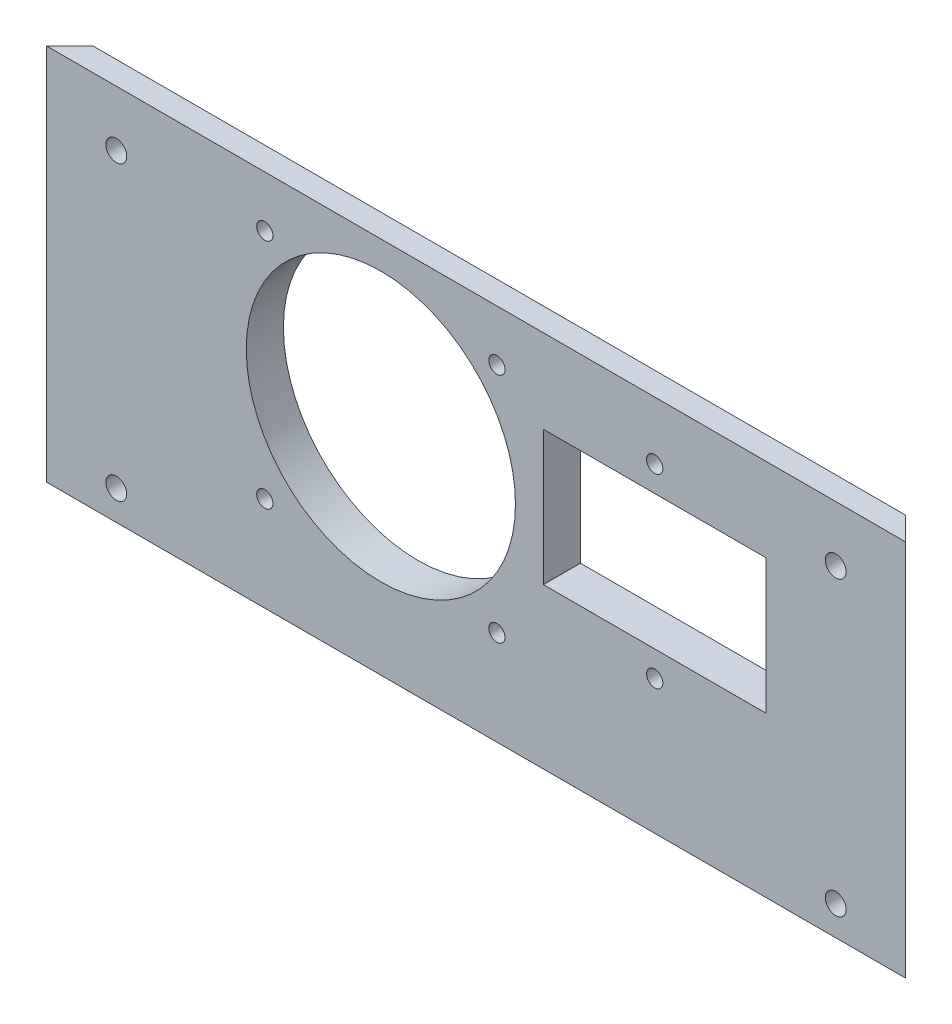
from build123d import *

# Parameters (mm, degrees)
SKETCH1_W           = 185
SKETCH1_H           = 84
SKETCH1_R           = 2.25
BOSS_EXTRUDE1_DEPTH = 5
SKETCH2_W           = 185
SKETCH2_H           = 79
SKETCH2_R           = 2.25
BOSS_EXTRUDE2_DEPTH = 3
CHAMFER1_SIZE       = 8
CHAMFER3_SIZE       = 3
SKETCH3_W           = 7.071067812
SKETCH3_H           = 2.6
CUT_EXTRUDE1_DEPTH  = 221.270985121
SKETCH4_R           = 29
SKETCH4_R_2         = 1.75
SKETCH4_W           = 48
SKETCH4_H           = 29
CUT_EXTRUDE2_DEPTH  = 204.334699449


with BuildPart() as part:
    # Sketch1 → Boss-Extrude1 (new body)
    with BuildSketch(Plane.XY):
        with Locations((92.5, 42)):
            Rectangle(SKETCH1_W, SKETCH1_H)
        with Locations((15, 9)):
            Circle(SKETCH1_R, mode=Mode.SUBTRACT)
        with Locations(Location((170, 9, 0), (0, 0, 180))):
            Circle(SKETCH1_R, mode=Mode.SUBTRACT)
        with Locations((15, 72)):
            Circle(SKETCH1_R, mode=Mode.SUBTRACT)
        with Locations(Location((170, 72, 0), (0, 0, 180))):
            Circle(SKETCH1_R, mode=Mode.SUBTRACT)
    extrude(amount=-BOSS_EXTRUDE1_DEPTH)

    # Sketch2 → Boss-Extrude2 (add)
    with BuildSketch(Plane(origin=(0, 0, -5), x_dir=(-1, 0, 0), z_dir=(0, 0, -1))):
        with Locations((-92.5, 44.5)):
            Rectangle(SKETCH2_W, SKETCH2_H)
        with Locations(Location((-15, 9, 0), (0, 0, 180))):
            Circle(SKETCH2_R, mode=Mode.SUBTRACT)
        with Locations((-170, 9)):
            Circle(SKETCH2_R, mode=Mode.SUBTRACT)
        with Locations(Location((-15, 72, 0), (0, 0, 180))):
            Circle(SKETCH2_R, mode=Mode.SUBTRACT)
        with Locations((-170, 72)):
            Circle(SKETCH2_R, mode=Mode.SUBTRACT)
    extrude(amount=BOSS_EXTRUDE2_DEPTH)

    # Chamfer1
    # the kernel refuses this chamfer: 8 mm, written as the material it takes off along each edge
    with BuildSketch(Plane(origin=(185, -15.573463904, -8), x_dir=(-0.9996219169112968, 0, -0.027495876610586296), z_dir=(0, 1, 0)), Plane(origin=(0, 104.573463904, -8), x_dir=(0.9996219169112968, 0, -0.027495876610586275), z_dir=(0, -1, 0))) as chamfer1_piece_1:
        Polygon((CHAMFER1_SIZE * 0.999621916911, CHAMFER1_SIZE * 0.0274958766106), (-CHAMFER1_SIZE * 0.0274958766106, CHAMFER1_SIZE * 0.999621916911), (0, 0), align=None)
    extrude(amount=120.146927807, mode=Mode.SUBTRACT)

    # Chamfer3
    chamfer3_edges = [part.edges().sort_by_distance(p)[0] for p in [
        (92.5, 84, -8),
    ]]
    chamfer(chamfer3_edges, length=CHAMFER3_SIZE)

    # Sketch3 → Cut-Extrude1 (cut, through all, along a direction that is not the sketch's normal)
    with BuildSketch(Plane(origin=(92.5, 0, -92.5), x_dir=(-0.7071067811865452, 0, -0.7071067811865498), z_dir=(0.7071067811865498, 0, -0.7071067811865452))):
        with Locations((-127.279220614, 1.3)):
            Rectangle(SKETCH3_W, SKETCH3_H)
    extrude(amount=-CUT_EXTRUDE1_DEPTH, dir=(1, 0, 0), mode=Mode.SUBTRACT)

    # Sketch4 → Cut-Extrude2 (cut, through all)
    with BuildSketch(Plane.XY):
        with Locations((72, 49)):
            Circle(SKETCH4_R)
        with Locations((47, 73)):
            Circle(SKETCH4_R_2)
        with Locations((97, 73)):
            Circle(SKETCH4_R_2)
        with Locations((97, 23)):
            Circle(SKETCH4_R_2)
        with Locations((47, 23)):
            Circle(SKETCH4_R_2)
        with Locations((131, 71.5)):
            Circle(SKETCH4_R_2)
        with Locations((131, 31.5)):
            Circle(SKETCH4_R_2)
        with Locations((131, 51.5)):
            Rectangle(SKETCH4_W, SKETCH4_H)
    extrude(amount=-CUT_EXTRUDE2_DEPTH, mode=Mode.SUBTRACT)


solid = part.part
